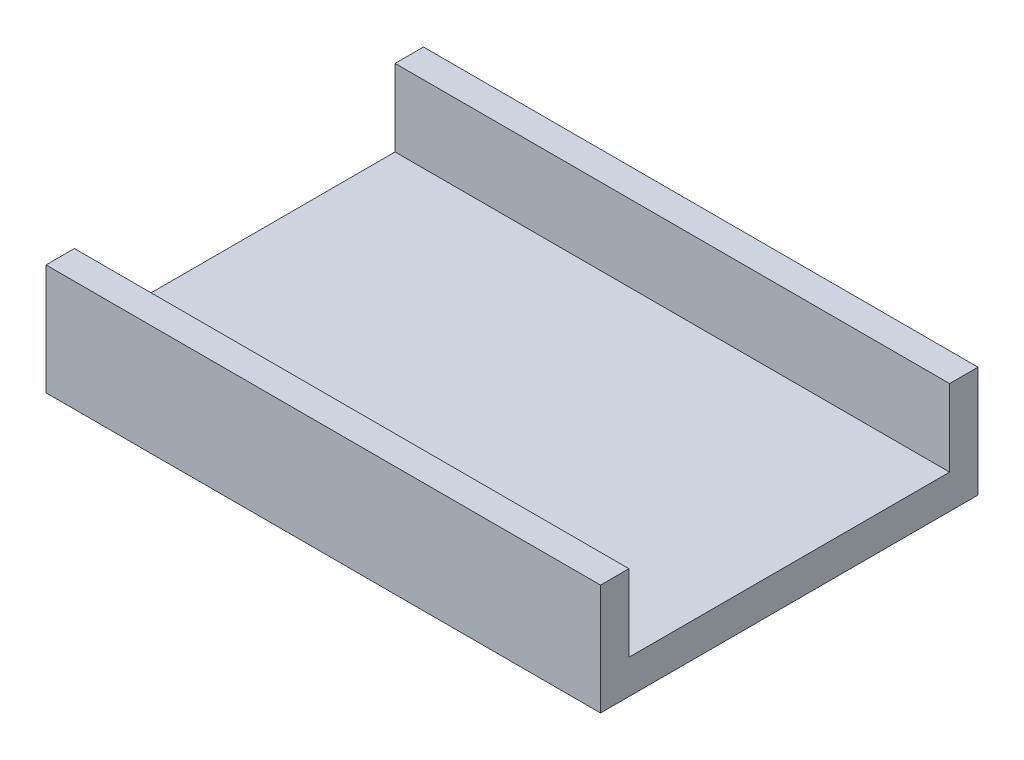
from build123d import *

# Parameters (mm, degrees)
SKETCH1_W           = 97.6
SKETCH1_H           = 66.43745389
BOSS_EXTRUDE1_DEPTH = 6
SKETCH4_W           = 97.6
SKETCH4_H           = 66.43745389
SKETCH4_W_2         = 55
SKETCH4_H_2         = 54
BOSS_EXTRUDE2_DEPTH = 13.5
SKETCH6_W           = 97.6
SKETCH6_H           = 56.43745389
CUT_EXTRUDE2_DEPTH  = 13.5


with BuildPart() as part:
    # Sketch1 → Boss-Extrude1 (new body)
    with BuildSketch(Plane(origin=(0, 0, 0), x_dir=(1, 0, 0), z_dir=(0, 1, 0))):
        Rectangle(SKETCH1_W, SKETCH1_H)
    extrude(amount=BOSS_EXTRUDE1_DEPTH)

    # Sketch4 → Boss-Extrude2 (add)
    with BuildSketch(Plane(origin=(0, 6, 0), x_dir=(1, 0, 0), z_dir=(0, 1, 0))):
        Rectangle(SKETCH4_W, SKETCH4_H)
        with Locations((3.3, 0)):
            Rectangle(SKETCH4_W_2, SKETCH4_H_2, mode=Mode.SUBTRACT)
    extrude(amount=BOSS_EXTRUDE2_DEPTH)

    # Sketch6 → Cut-Extrude2 (cut)
    with BuildSketch(Plane(origin=(0, 19.5, 0), x_dir=(1, 0, 0), z_dir=(0, 1, 0))):
        Rectangle(SKETCH6_W, SKETCH6_H)
    extrude(amount=-CUT_EXTRUDE2_DEPTH, mode=Mode.SUBTRACT)


solid = part.part
